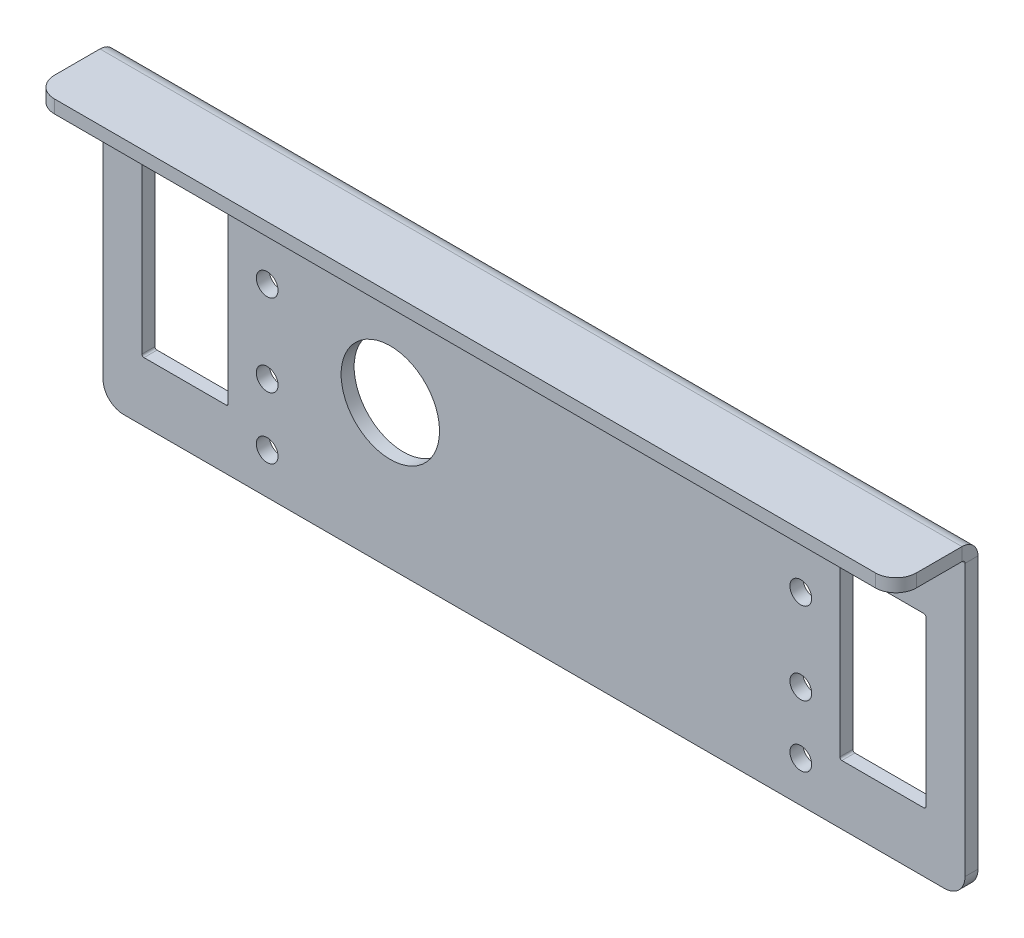
from build123d import *

# Parameters (mm, degrees)
SKETCH1_W                    = 210
SKETCH1_H                    = 75
SKETCH1_R                    = 11.9875
SKETCH1_W_2                  = 21
SKETCH1_H_2                  = 41
BASE_FLANGE1_DEPTH           = 3.175
EDGE_FLANGE1_STRIP_W         = 14.1732
EDGE_FLANGE1_STRIP_H         = 3.175
EDGE_FLANGE1_STRIP_CUT_DEPTH = 210
EDGE_FLANGE1_DEPTH           = 210
M5_CLEARANCE_HOLE1_D         = 5.3
FILLET1_R                    = 5
FILLET2_R                    = 0.5


# Sheet-metal steps are written as plain solids
with BuildPart() as part:
    # Sketch1 → Base-Flange1 (new body)
    with BuildSketch(Plane.XY):
        with Locations((35, 2.5)):
            Rectangle(SKETCH1_W, SKETCH1_H)
        Circle(SKETCH1_R, mode=Mode.SUBTRACT)
        with Locations((-50, 0)):
            Rectangle(SKETCH1_W_2, SKETCH1_H_2, mode=Mode.SUBTRACT)
        with Locations((120, 0)):
            Rectangle(SKETCH1_W_2, SKETCH1_H_2, mode=Mode.SUBTRACT)
    extrude(amount=-BASE_FLANGE1_DEPTH)

    # Edge-Flange1 strip (across the edge) → Edge-Flange1 strip cut (cut)
    with BuildSketch(Plane(origin=(140, 40, 0), x_dir=(0, -1, 0), z_dir=(-1, 0, 0))):
        with Locations((-3.175, -1.5875)):
            Rectangle(EDGE_FLANGE1_STRIP_W, EDGE_FLANGE1_STRIP_H)
    extrude(amount=EDGE_FLANGE1_STRIP_CUT_DEPTH, mode=Mode.SUBTRACT)

    # Edge-Flange1 section (across the edge) → Edge-Flange1 (add)
    with BuildSketch(Plane(origin=(140, 40, 0), x_dir=(0, -1, 0), z_dir=(-1, 0, 0))):
        with BuildLine():
            Line((0, 0.7366), (0, 16.825))
            Line((0, 16.825), (3.175, 16.825))
            Line((3.175, 16.825), (3.175, 0.7366))
            ThreePointArc((3.175, 0.7366), (3.390745145, 0.215745145), (3.9116, 0))
            Line((3.9116, 0), (3.9116, -3.175))
            ThreePointArc((3.9116, -3.175), (1.145681115, -2.029318885), (0, 0.7366))
        make_face()
    extrude(amount=EDGE_FLANGE1_DEPTH)

    # M5 Clearance Hole1 (through all)
    with Locations(Plane(origin=(-30, 25, 0), x_dir=(1, 0, 0), z_dir=(0, 0, 1))):
        with Locations((0, 0), (0, -50), (130, -50), (130, 0), (0, -15), (0, -35), (130, -35), (130, -15)):
            Hole(M5_CLEARANCE_HOLE1_D / 2)

    # Fillet1
    fillet1_edges = [part.edges().sort_by_distance(p)[0] for p in [
        (140, 38.4125, 16.825),
        (-70, 38.4125, 16.825),
        (140, -35, -1.5875),
        (-70, -35, -1.5875),
    ]]
    fillet(fillet1_edges, radius=FILLET1_R)

    # Fillet2
    fillet2_edges = [part.edges().sort_by_distance(p)[0] for p in [
        (-60.5, -20.5, -1.5875),
        (-60.5, 20.5, -1.5875),
        (-39.5, 20.5, -1.5875),
        (-39.5, -20.5, -1.5875),
        (109.5, -20.5, -1.5875),
        (109.5, 20.5, -1.5875),
        (130.5, 20.5, -1.5875),
        (130.5, -20.5, -1.5875),
    ]]
    fillet(fillet2_edges, radius=FILLET2_R)


solid = part.part
